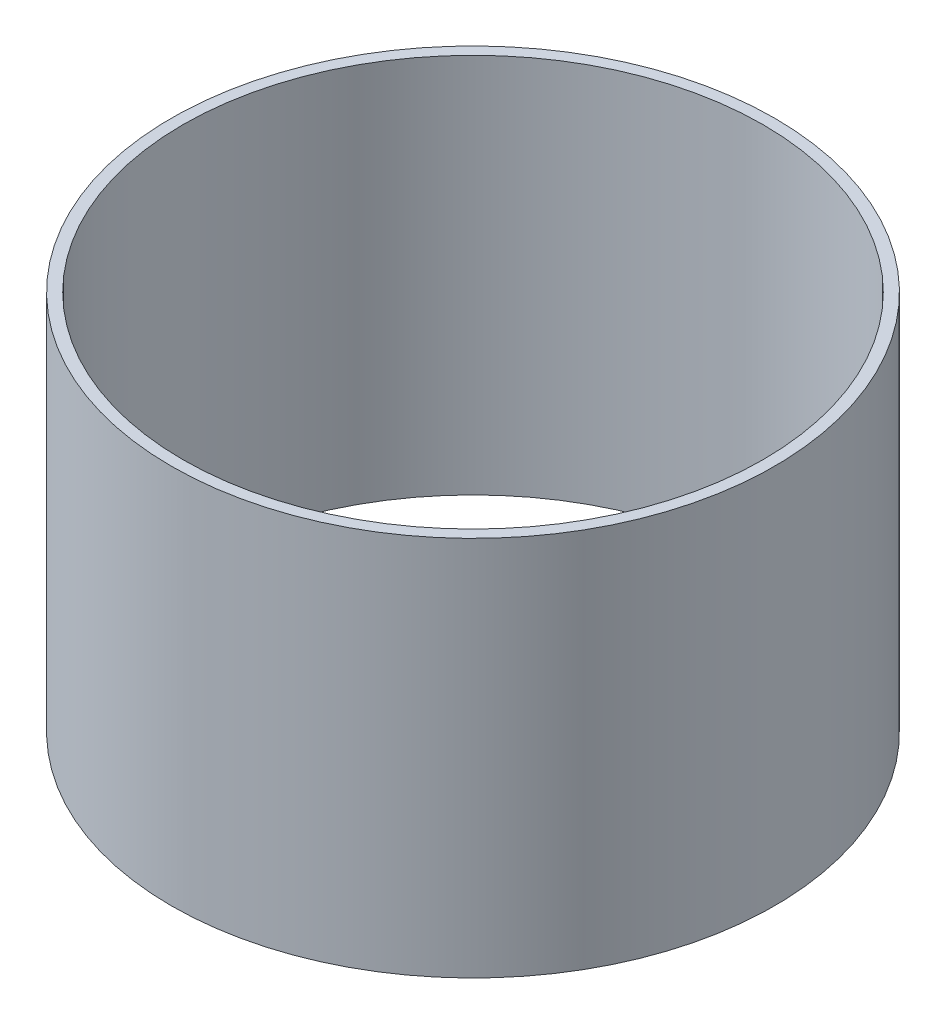
from build123d import *

# Parameters (mm, degrees)
SKETCH1_R           = 39.6
SKETCH1_R_2         = 38.1
BOSS_EXTRUDE1_DEPTH = 50


with BuildPart() as part:
    # Sketch1 → Boss-Extrude1 (new body)
    with BuildSketch(Plane(origin=(0, 0, 0), x_dir=(1, 0, 0), z_dir=(0, 1, 0))):
        Circle(SKETCH1_R)
        Circle(SKETCH1_R_2, mode=Mode.SUBTRACT)
    extrude(amount=BOSS_EXTRUDE1_DEPTH)


solid = part.part
